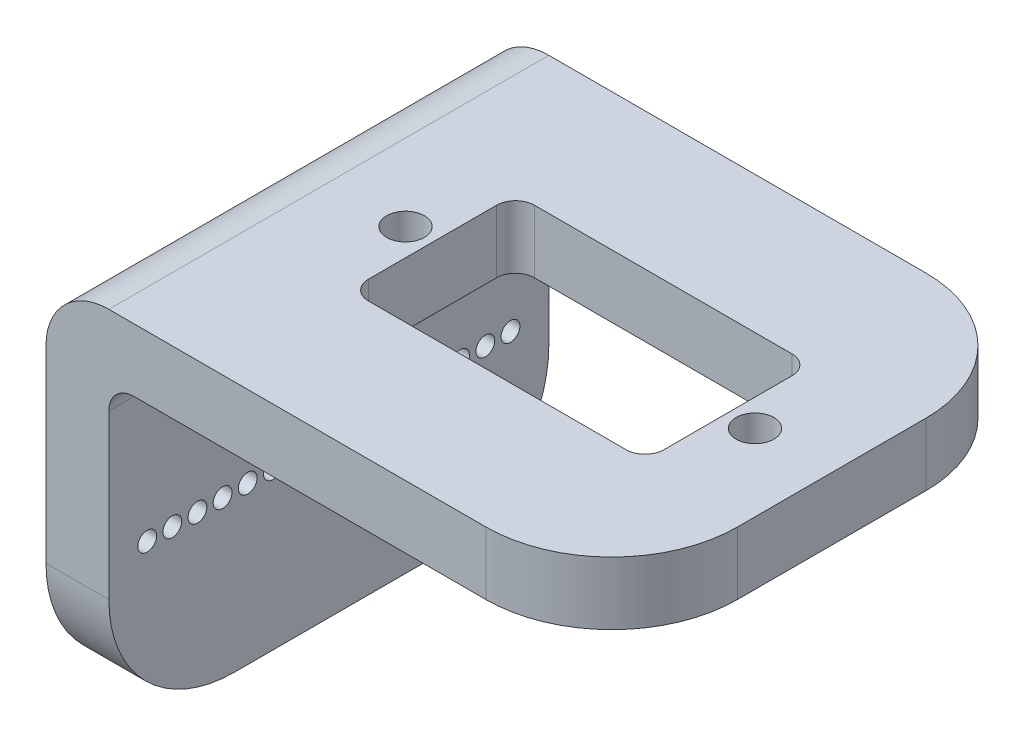
from build123d import *

# Parameters (mm, degrees)
SKETCH1_W           = 35
SKETCH1_H           = 25
SKETCH1_R           = 0.75
SKETCH1_R_2         = 2.5
BOSS_EXTRUDE1_DEPTH = 5
SKETCH4_W           = 45
SKETCH4_H           = 35
BOSS_EXTRUDE2_DEPTH = 5
CUT_EXTRUDE2_REACH  = 47.894
SKETCH3_R           = 1.5
SKETCH3_W           = 13.2
SKETCH3_H           = 23.5
FILLET1_R           = 10
FILLET2_R           = 5
FILLET3_R           = 2
FILLET4_R           = 10
FILLET5_R           = 1.5


with BuildPart() as part:
    # Sketch1 → Boss-Extrude1 (new body)
    with BuildSketch(Plane(origin=(0, 0, 0), x_dir=(0, 0, -1), z_dir=(1, 0, 0))):
        Rectangle(SKETCH1_W, SKETCH1_H)
        with Locations((-14.45, 0)):
            Circle(SKETCH1_R, mode=Mode.SUBTRACT)
        with Locations((-12.45, 0)):
            Circle(SKETCH1_R, mode=Mode.SUBTRACT)
        with Locations((-10.45, 0)):
            Circle(SKETCH1_R, mode=Mode.SUBTRACT)
        with Locations((-8.45, 0)):
            Circle(SKETCH1_R, mode=Mode.SUBTRACT)
        with Locations((-6.45, 0)):
            Circle(SKETCH1_R, mode=Mode.SUBTRACT)
        with Locations((-4.45, 0)):
            Circle(SKETCH1_R, mode=Mode.SUBTRACT)
        Circle(SKETCH1_R_2, mode=Mode.SUBTRACT)
        with Locations((4.45, 0)):
            Circle(SKETCH1_R, mode=Mode.SUBTRACT)
        with Locations((6.45, 0)):
            Circle(SKETCH1_R, mode=Mode.SUBTRACT)
        with Locations((8.45, 0)):
            Circle(SKETCH1_R, mode=Mode.SUBTRACT)
        with Locations((10.45, 0)):
            Circle(SKETCH1_R, mode=Mode.SUBTRACT)
        with Locations((12.45, 0)):
            Circle(SKETCH1_R, mode=Mode.SUBTRACT)
        with Locations((14.45, 0)):
            Circle(SKETCH1_R, mode=Mode.SUBTRACT)
    extrude(amount=BOSS_EXTRUDE1_DEPTH)

    # Sketch4 → Boss-Extrude2 (add)
    with BuildSketch(Plane(origin=(0, 12.5, 0), x_dir=(1, 0, 0), z_dir=(0, 1, 0))):
        with Locations((22.5, 0)):
            Rectangle(SKETCH4_W, SKETCH4_H)
    extrude(amount=BOSS_EXTRUDE2_DEPTH)

    # Sketch3 → Cut-Extrude2 (cut, up to next)
    with BuildSketch(Plane(origin=(30, 17.5, 0), x_dir=(0, 0, -1), z_dir=(0, 1, 0)), mode=Mode.PRIVATE) as cut_extrude2_sk1:
        with Locations((0, 18.9)):
            Circle(SKETCH3_R)
    cut_extrude2_tool1 = extrude(cut_extrude2_sk1.sketch, amount=-CUT_EXTRUDE2_REACH, mode=Mode.PRIVATE) & part.part
    # Sketch3 → Cut-Extrude2 (cut, up to next)
    with BuildSketch(Plane(origin=(30, 17.5, 0), x_dir=(0, 0, -1), z_dir=(0, 1, 0)), mode=Mode.PRIVATE) as cut_extrude2_sk2:
        with Locations((0, -8.9)):
            Circle(SKETCH3_R)
    cut_extrude2_tool2 = extrude(cut_extrude2_sk2.sketch, amount=-CUT_EXTRUDE2_REACH, mode=Mode.PRIVATE) & part.part
    # Sketch3 → Cut-Extrude2 (cut, up to next)
    with BuildSketch(Plane(origin=(30, 17.5, 0), x_dir=(0, 0, -1), z_dir=(0, 1, 0)), mode=Mode.PRIVATE) as cut_extrude2_sk3:
        with Locations((0, 5)):
            Rectangle(SKETCH3_W, SKETCH3_H)
    cut_extrude2_tool3 = extrude(cut_extrude2_sk3.sketch, amount=-CUT_EXTRUDE2_REACH, mode=Mode.PRIVATE) & part.part
    add(cut_extrude2_tool1.solids().sort_by_distance((11.1, 17.5, 0))[0], mode=Mode.SUBTRACT)
    add(cut_extrude2_tool2.solids().sort_by_distance((38.9, 17.5, 0))[0], mode=Mode.SUBTRACT)
    add(cut_extrude2_tool3.solids().sort_by_distance((25, 17.5, 0))[0], mode=Mode.SUBTRACT)

    # Fillet1
    fillet1_edges = [part.edges().sort_by_distance(p)[0] for p in [
        (45, 15, -17.5),
        (45, 15, 17.5),
    ]]
    fillet(fillet1_edges, radius=FILLET1_R)

    # Fillet2
    fillet2_edges = [part.edges().sort_by_distance(p)[0] for p in [
        (0, 17.5, 0),
    ]]
    fillet(fillet2_edges, radius=FILLET2_R)

    # Fillet3
    fillet3_edges = [part.edges().sort_by_distance(p)[0] for p in [
        (5, 12.5, 0),
    ]]
    fillet(fillet3_edges, radius=FILLET3_R)

    # Fillet4
    fillet4_edges = [part.edges().sort_by_distance(p)[0] for p in [
        (2.5, -12.5, -17.5),
        (2.5, -12.5, 17.5),
    ]]
    fillet(fillet4_edges, radius=FILLET4_R)

    # Fillet5
    fillet5_edges = [part.edges().sort_by_distance(p)[0] for p in [
        (13.25, 15, -6.6),
        (36.75, 15, -6.6),
        (36.75, 15, 6.6),
        (13.25, 15, 6.6),
    ]]
    fillet(fillet5_edges, radius=FILLET5_R)


solid = part.part
